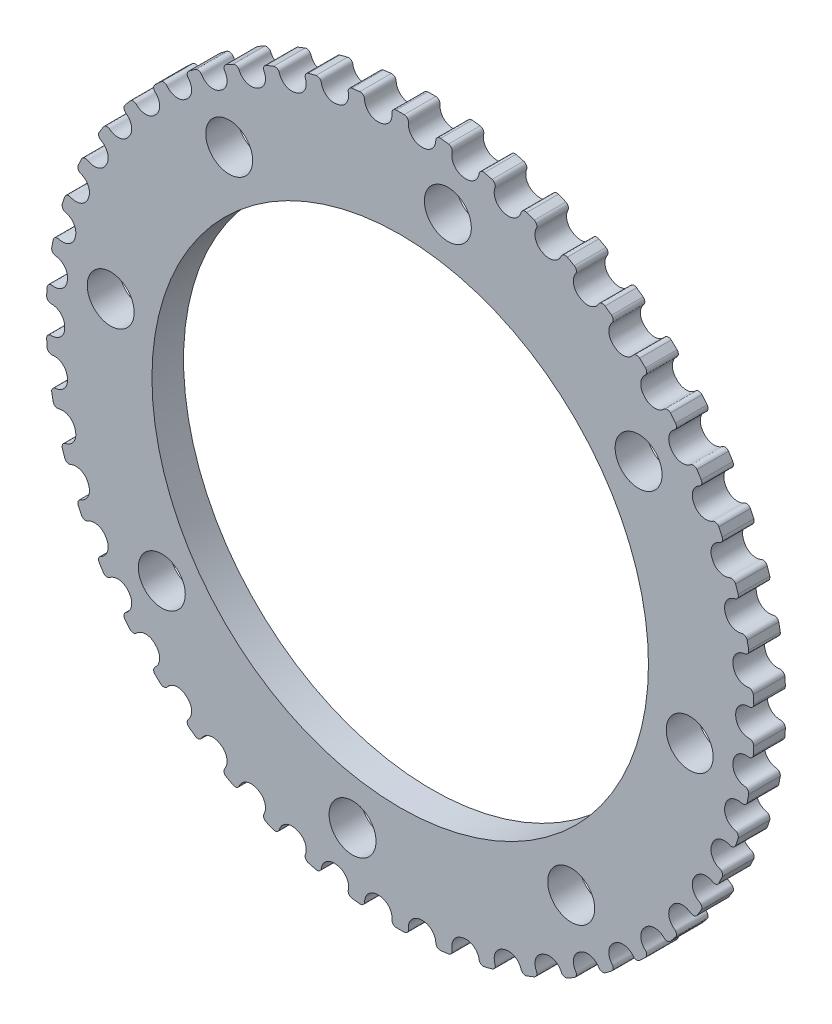
from build123d import *

# Parameters (mm, degrees)
SKETCHREVOLVEGEARBELT01_W       = 3.5
SKETCHREVOLVEGEARBELT01_H       = 39.217218411
TOOTHEXTRUDECUTGEARBELT01_DEPTH = 7.238999891
PATTERNGEARBELT01_COUNT         = 50
BOREREVOLVESKETCH_W             = 14.477999782
BOREREVOLVESKETCH_H             = 27.5
SKETCH1_R                       = 2.6
CUT_EXTRUDE1_DEPTH              = 10


with BuildPart() as part:
    # SketchRevolveGearBelt01 → GearBelt01 (revolve)
    with BuildSketch(Plane(origin=(0, 0, 0), x_dir=(0, 0, -1), z_dir=(1, 0, 0))):
        with Locations((0, 19.608609206)):
            Rectangle(SKETCHREVOLVEGEARBELT01_W, SKETCHREVOLVEGEARBELT01_H)
    revolve(axis=Axis((0, 0, 0), (0, 0, -1)))

    # SketchToothGearBelt01 → ToothExtrudeCutGearBelt01 (cut, symmetric)
    with BuildSketch(Plane.XY):
        with BuildLine():
            ThreePointArc((39.164679022, 2.032334243), (39.217374535, 0), (39.164679022, -2.032334243))
            add(Edge.make_bspline(
                [(39.164679022, -2.032334243), (39.166048883, -2.005984565), (39.164883295, -1.966294001), (39.156943231, -1.91408071), (39.147835553, -1.875531869), (39.135634795, -1.83784758), (39.12042125, -1.801275572), (39.102294908, -1.766056265), (39.081374934, -1.732421187), (39.057798852, -1.700591449), (39.031721649, -1.670776298), (39.003314752, -1.64317173), (38.972764904, -1.617959231), (38.940272938, -1.59530448), (38.906052449, -1.575356646), (38.870328405, -1.558245974), (38.833335623, -1.544088262), (38.795317397, -1.532964211), (38.756523252, -1.524993116), (38.717209712, -1.520055082), (38.66580266, -1.5184582), (38.589994052, -1.519756698), (38.489697952, -1.516042965), (38.377509936, -1.502613699), (38.266707897, -1.480535762), (38.157982142, -1.449806634), (38.052000418, -1.410652745), (37.949416183, -1.363305357), (37.850861265, -1.308058822), (37.756942857, -1.245252774), (37.668239537, -1.175274325), (37.585297771, -1.098554529), (37.50862852, -1.015566038), (37.43870413, -0.926820101), (37.375955295, -0.832863447), (37.320768875, -0.73427489), (37.27348376, -0.631661826), (37.234395318, -0.525656278), (37.203729181, -0.416911781), (37.181730901, -0.306096466), (37.168324647, -0.193899714), (37.165224472, -0.105119728), (37.165512565, -0.040500395), (37.16545238, 0), (37.165512565, 0.040500395), (37.165224472, 0.105119728), (37.168324647, 0.193899714), (37.181730901, 0.306096466), (37.203729181, 0.416911781), (37.234395318, 0.525656278), (37.27348376, 0.631661826), (37.320768875, 0.73427489), (37.375955295, 0.832863447), (37.43870413, 0.926820101), (37.50862852, 1.015566038), (37.585297771, 1.098554529), (37.668239537, 1.175274325), (37.756942857, 1.245252774), (37.850861265, 1.308058822), (37.949416183, 1.363305357), (38.052000418, 1.410652745), (38.157982142, 1.449806634), (38.266707897, 1.480535762), (38.377509936, 1.502613699), (38.489697952, 1.516042965), (38.589994052, 1.519756698), (38.66580266, 1.5184582), (38.717209712, 1.520055082), (38.756523252, 1.524993116), (38.795317397, 1.532964211), (38.833335623, 1.544088262), (38.870328405, 1.558245974), (38.906052449, 1.575356646), (38.940272938, 1.59530448), (38.972764904, 1.617959231), (39.003314752, 1.64317173), (39.031721649, 1.670776298), (39.057798852, 1.700591449), (39.081374934, 1.732421187), (39.102294908, 1.766056265), (39.12042125, 1.801275572), (39.135634795, 1.83784758), (39.147835553, 1.875531869), (39.156943231, 1.91408071), (39.164883295, 1.966294001), (39.166048883, 2.005984565), (39.164679022, 2.032334243)],
                knots=[0, 0, 0, 0, 0.012346399, 0.018519598, 0.024692797, 0.030865997, 0.037039196, 0.043212395, 0.049385595, 0.055558794, 0.061731993, 0.067905193, 0.074078392, 0.080251591, 0.086424791, 0.09259799, 0.09877119, 0.104944389, 0.111117588, 0.117290788, 0.123463987, 0.135171051, 0.152780618, 0.170390185, 0.187999752, 0.205609319, 0.223218886, 0.240828453, 0.25843802, 0.276047587, 0.293657154, 0.311266721, 0.328876288, 0.346485855, 0.364095422, 0.381704989, 0.399314555, 0.416924122, 0.434533689, 0.452143256, 0.469752823, 0.48736239, 0.493681195, 0.5, 0.506318805, 0.51263761, 0.530247177, 0.547856744, 0.565466311, 0.583075878, 0.600685445, 0.618295011, 0.635904578, 0.653514145, 0.671123712, 0.688733279, 0.706342846, 0.723952413, 0.74156198, 0.759171547, 0.776781114, 0.794390681, 0.812000248, 0.829609815, 0.847219382, 0.864828949, 0.876536013, 0.882709212, 0.888882412, 0.895055611, 0.90122881, 0.90740201, 0.913575209, 0.919748409, 0.925921608, 0.932094807, 0.938268007, 0.944441206, 0.950614405, 0.956787605, 0.962960804, 0.969134003, 0.975307203, 0.981480402, 0.987653601, 1, 1, 1, 1], degree=3))
        make_face()
    toothextrudecutgearbelt01 = extrude(amount=TOOTHEXTRUDECUTGEARBELT01_DEPTH, both=True, mode=Mode.SUBTRACT)

    # PatternGearBelt01: ToothExtrudeCutGearBelt01 ×50 about axis
    patterngearbelt01_axis = Axis((0, 0, 55), (0, 0, -1))
    for i in range(1, PATTERNGEARBELT01_COUNT):
        add(toothextrudecutgearbelt01.rotate(patterngearbelt01_axis, i * 360 / PATTERNGEARBELT01_COUNT), mode=Mode.SUBTRACT)

    # BoreRevolveSketch → BoreRevolveCut (revolve, cut)
    with BuildSketch(Plane(origin=(0, 0, 0), x_dir=(0, 0, -1), z_dir=(1, 0, 0))):
        with Locations((0, 13.75)):
            Rectangle(BOREREVOLVESKETCH_W, BOREREVOLVESKETCH_H)
    revolve(axis=Axis((0, 0, 0), (0, 0, -1)), mode=Mode.SUBTRACT)

    # Sketch1 → Cut-Extrude1 (cut)
    with BuildSketch(Plane.XY.offset(1.75)):
        with Locations((-18.943179255, 26.408444856)):
            Circle(SKETCH1_R)
        with Locations((5.27873993, 32.068440947)):
            Circle(SKETCH1_R)
        with Locations((26.408444856, 18.943179255)):
            Circle(SKETCH1_R)
        with Locations((32.068440947, -5.27873993)):
            Circle(SKETCH1_R)
        with Locations((18.943179255, -26.408444856)):
            Circle(SKETCH1_R)
        with Locations((-5.27873993, -32.068440947)):
            Circle(SKETCH1_R)
        with Locations((-32.068440947, 5.27873993)):
            Circle(SKETCH1_R)
        with Locations((-26.408444856, -18.943179255)):
            Circle(SKETCH1_R)
    extrude(amount=-CUT_EXTRUDE1_DEPTH, mode=Mode.SUBTRACT)


solid = part.part
